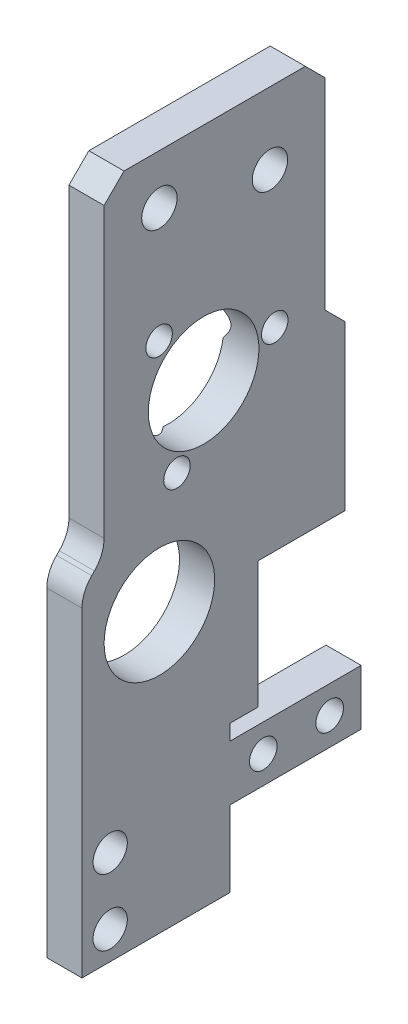
from build123d import *

# Parameters (mm, degrees)
SKETCH1_R                                       = 5
SKETCH1_R_2                                     = 1.6
SKETCH1_R_3                                     = 1.25
SKETCH1_R_4                                     = 1.55
BOSS_EXTRUDE1_DEPTH                             = 3.18
CSK_FOR_M2_FLAT_HEAD_MACHINE_SCREW1_D           = 2.4
CSK_FOR_M2_FLAT_HEAD_MACHINE_SCREW1_DEPTH       = 3.508967257
CSK_FOR_M2_FLAT_HEAD_MACHINE_SCREW1_CSINK_D     = 4.4
CSK_FOR_M2_FLAT_HEAD_MACHINE_SCREW1_CSINK_ANGLE = 90
CSK_FOR_M2_FLAT_HEAD_MACHINE_SCREW1_TIP         = 0.721032743
SKETCH3_R                                       = 5
CUT_EXTRUDE4_DEPTH                              = 67.382158748
FILLET2_R                                       = 3
CHAMFER2_SIZE                                   = 1.8


with BuildPart() as part:
    # Sketch1 → Boss-Extrude1 (new body)
    with BuildSketch(Plane(origin=(0, 0, 0), x_dir=(0, 0, -1), z_dir=(1, 0, 0))):
        Polygon((0, 0), (0, 30.2), (2, 32.2), (2, 61.31), (22, 61.31), (22, 41.31), (23.8, 41.31), (23.8, 24.71), (15.9, 24.71), (15.9, 13.26), (13.4, 13.26), (13.4, 11.86), (25.25, 11.86), (25.25, 6.86), (13.4, 6.86), (13.4, 0), align=None)
        with Locations(Location((7, 25.2, 0), (0, 0, 180))):
            Circle(SKETCH1_R, mode=Mode.SUBTRACT)
        with Locations(Location((7, 56.81, 0), (0, 0, 180))):
            Circle(SKETCH1_R_2, mode=Mode.SUBTRACT)
        with Locations(Location((17, 54.81, 0), (0, 0, 180))):
            Circle(SKETCH1_R_2, mode=Mode.SUBTRACT)
        with Locations(Location((22.4, 9.36, 0), (0, 0, 180))):
            Circle(SKETCH1_R_3, mode=Mode.SUBTRACT)
        with Locations(Location((16.4, 9.36, 0), (0, 0, 180))):
            Circle(SKETCH1_R_3, mode=Mode.SUBTRACT)
        with Locations(Location((2.55, 2.55, 0), (0, 0, 180))):
            Circle(SKETCH1_R_4, mode=Mode.SUBTRACT)
        with Locations(Location((2.55, 8.55, 0), (0, 0, 180))):
            Circle(SKETCH1_R_4, mode=Mode.SUBTRACT)
    extrude(amount=BOSS_EXTRUDE1_DEPTH)

    # CSK for M2 Flat Head Machine Screw1
    with Locations(Plane.ZY):
        with Locations((-6.974936087, 46.414674329), (-17.432559713, 42.244769284), (-8.592504199, 35.273154083)):
            CounterSinkHole(CSK_FOR_M2_FLAT_HEAD_MACHINE_SCREW1_D / 2, CSK_FOR_M2_FLAT_HEAD_MACHINE_SCREW1_CSINK_D / 2, depth=CSK_FOR_M2_FLAT_HEAD_MACHINE_SCREW1_DEPTH, counter_sink_angle=CSK_FOR_M2_FLAT_HEAD_MACHINE_SCREW1_CSINK_ANGLE)
            with Locations((0, 0, -(CSK_FOR_M2_FLAT_HEAD_MACHINE_SCREW1_DEPTH + CSK_FOR_M2_FLAT_HEAD_MACHINE_SCREW1_TIP / 2))):  # 118° drill point
                Cone(0, CSK_FOR_M2_FLAT_HEAD_MACHINE_SCREW1_D / 2, CSK_FOR_M2_FLAT_HEAD_MACHINE_SCREW1_TIP, mode=Mode.SUBTRACT)

    # Sketch3 → Cut-Extrude4 (cut, through all)
    with BuildSketch(Plane.ZY):
        with Locations((-11, 41.310865899)):
            Circle(SKETCH3_R)
    extrude(amount=-CUT_EXTRUDE4_DEPTH, mode=Mode.SUBTRACT)

    # Fillet2
    fillet2_edges = [part.edges().sort_by_distance(p)[0] for p in [
        (1.59, 30.2, 0),
        (1.59, 32.2, -2),
    ]]
    fillet(fillet2_edges, radius=FILLET2_R)

    # Chamfer2
    chamfer2_edges = [part.edges().sort_by_distance(p)[0] for p in [
        (1.59, 61.31, -22),
        (1.59, 61.31, -2),
        (1.59, 41.31, -23.8),
    ]]
    chamfer(chamfer2_edges, length=CHAMFER2_SIZE - 0.0001)  # a hair under: the kernel refuses the full size


solid = part.part
